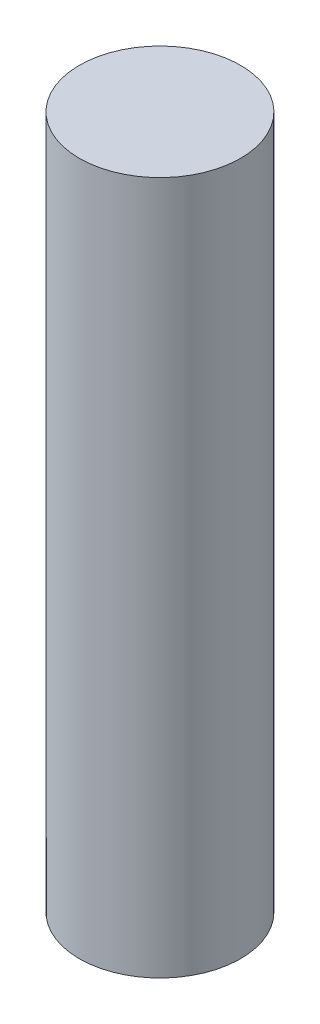
from build123d import *

# Parameters (mm, degrees)
SKETCH1_R           = 5
BOSS_EXTRUDE1_DEPTH = 43


with BuildPart() as part:
    # Sketch1 → Boss-Extrude1 (new body)
    with BuildSketch(Plane(origin=(0, 0, 0), x_dir=(1, 0, 0), z_dir=(0, 1, 0))):
        Circle(SKETCH1_R)
    extrude(amount=BOSS_EXTRUDE1_DEPTH)


solid = part.part
